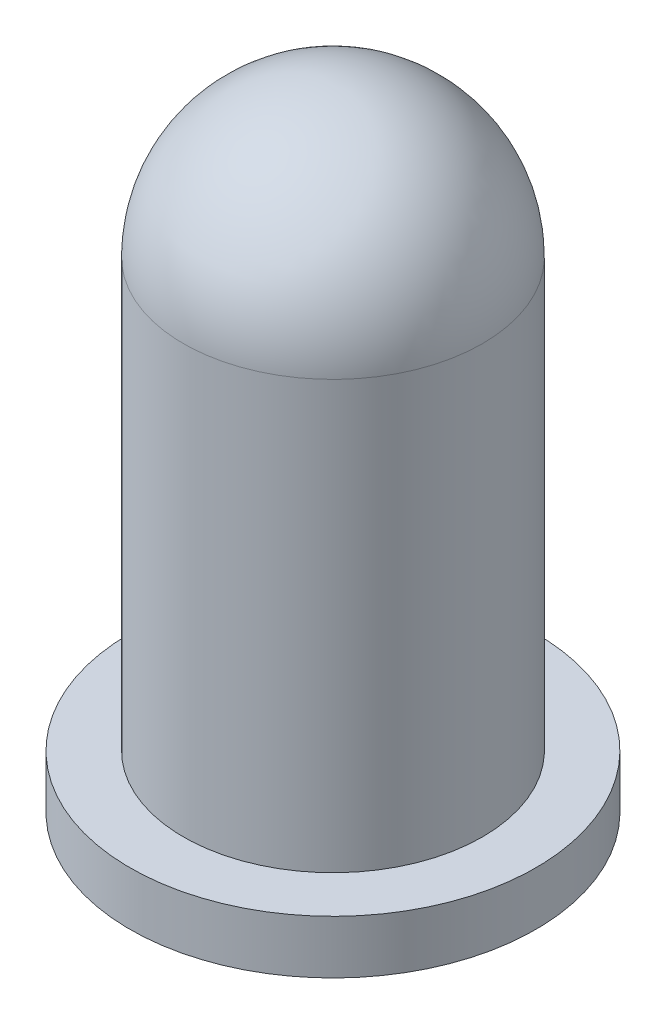
from build123d import *


with BuildPart() as part:
    # Sketch1 → Revolve2 (revolve)
    with BuildSketch(Plane.XY):
        with BuildLine():
            Line((1.4, 0.5), (1.4, 4.5))
            ThreePointArc((1.4, 4.5), (0.989949494, 5.489949494), (0, 5.9))
            Line((0, 5.9), (0, 0))
            Line((0, 0), (1.4, 0))
            Line((1.4, 0), (1.9, 0))
            Line((1.9, 0), (1.9, 0.5))
            Line((1.9, 0.5), (1.4, 0.5))
        make_face()
    revolve(axis=Axis((0, 5.9, 0), (0, -1, 0)))


solid = part.part
